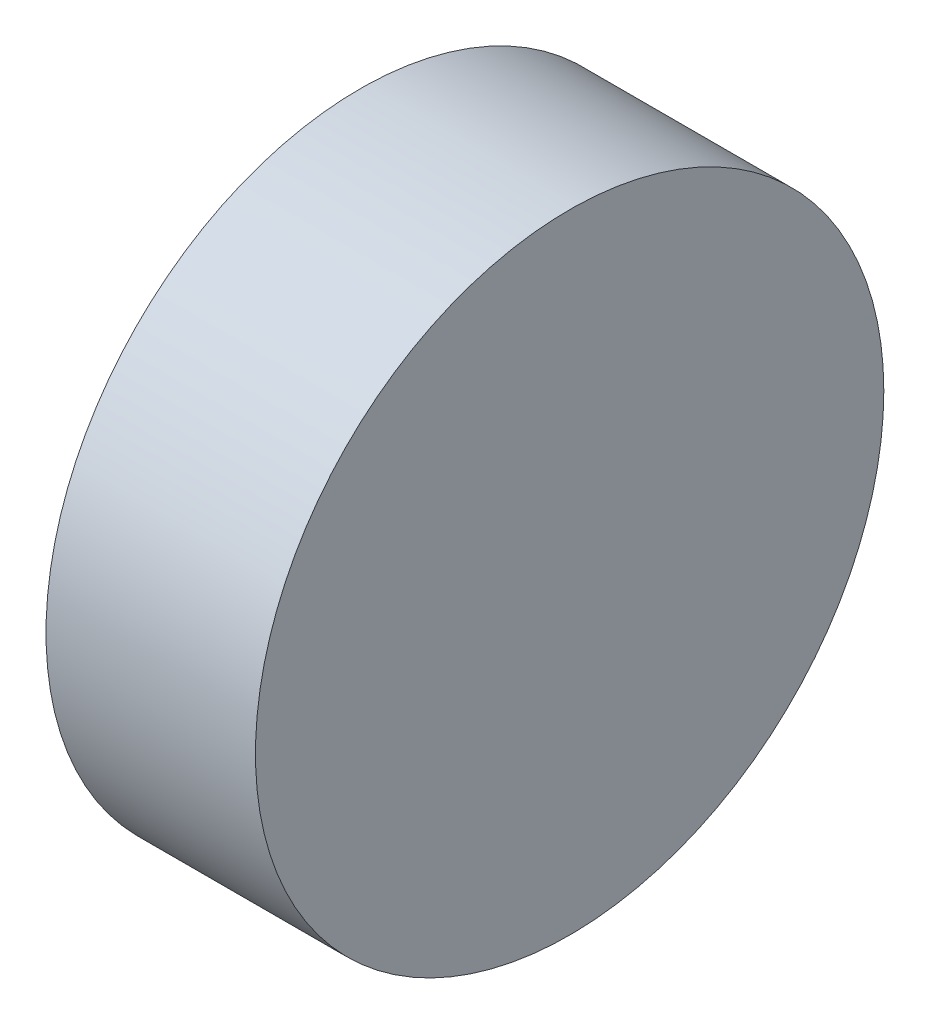
from build123d import *

# Parameters (mm, degrees)
BOSS_EXTRUDE1_DEPTH      = 12.7
BOSS_EXTRUDE1_DEPTH_BACK = 12.7
SKETCH1_R                = 38.1


with BuildPart() as part:
    # Sketch1 → Boss-Extrude1 (new, two sides: drawn at the far end of the back side and taken through both)
    with BuildSketch(Plane(origin=(0, 0, 0), x_dir=(0, 0, -1), z_dir=(1, 0, 0)).offset(-BOSS_EXTRUDE1_DEPTH_BACK)):
        Circle(SKETCH1_R)
    extrude(amount=BOSS_EXTRUDE1_DEPTH + BOSS_EXTRUDE1_DEPTH_BACK)


solid = part.part
